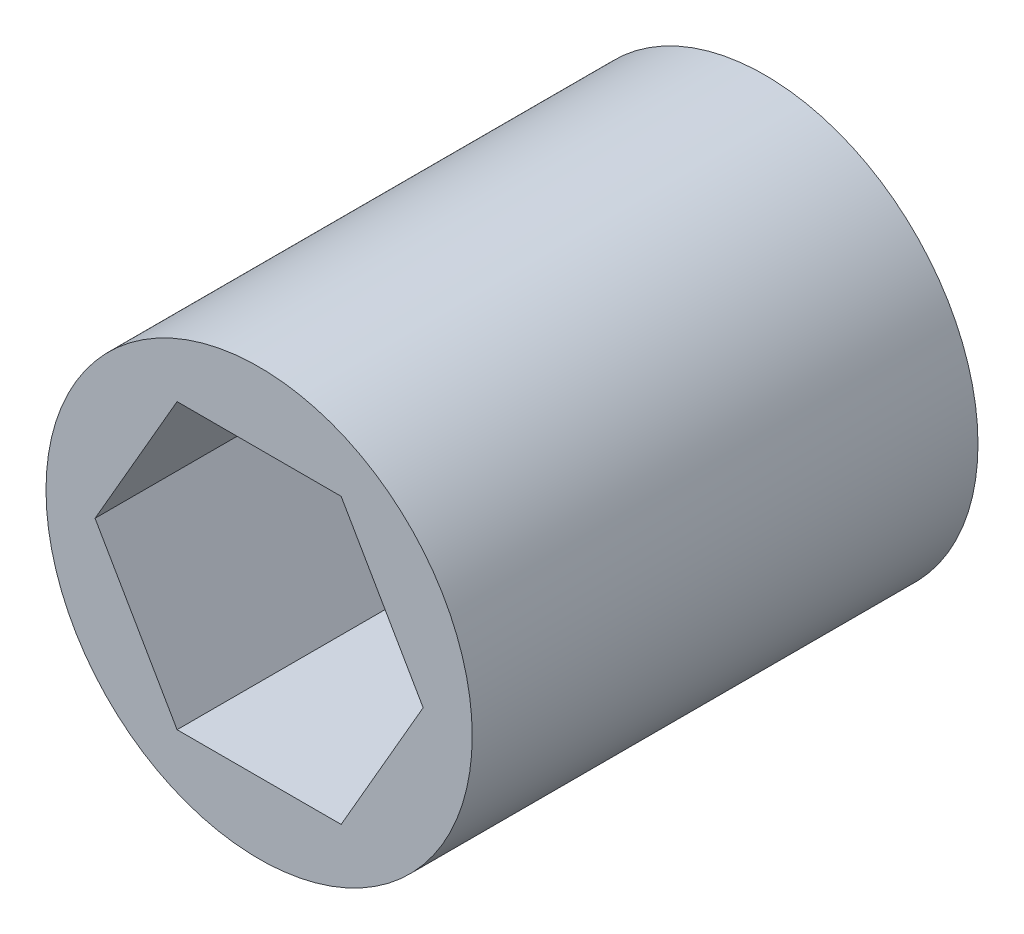
from build123d import *

# Parameters (mm, degrees)
SKETCH1_R           = 9.525
BOSS_EXTRUDE1_DEPTH = 22.606


with BuildPart() as part:
    # Sketch1 → Boss-Extrude1 (new body)
    with BuildSketch(Plane.XY):
        Circle(SKETCH1_R)
        Polygon((3.666174209, 6.35), (-3.666174209, 6.35), (-7.332348419, 0), (-3.666174209, -6.35), (3.666174209, -6.35), (7.332348419, 0), align=None, mode=Mode.SUBTRACT)
    extrude(amount=BOSS_EXTRUDE1_DEPTH)


solid = part.part
